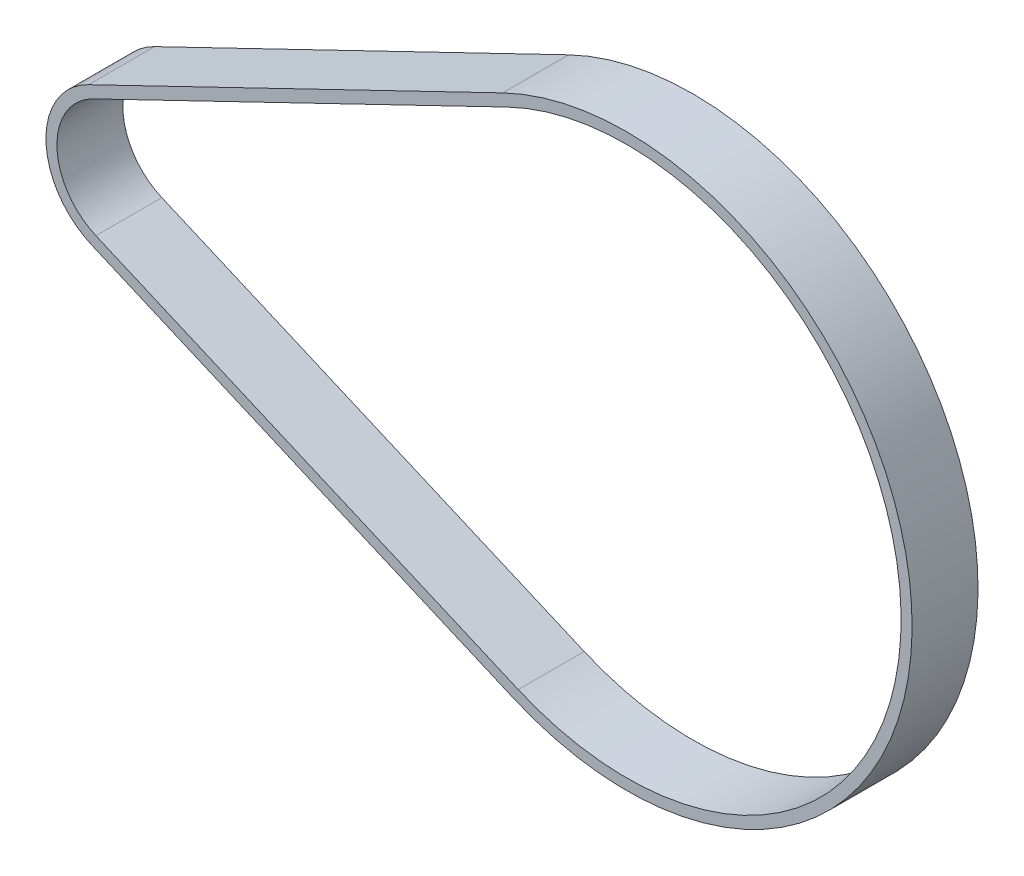
from build123d import *

# Parameters (mm, degrees)
EXTRUDE_THIN1_START = -1
EXTRUDE_THIN1_DEPTH = 6


with BuildPart() as part:
    # Sketch2 → Extrude-Thin1 (new body)
    with BuildSketch(Plane.XY.offset(EXTRUDE_THIN1_START)):
        with BuildLine():
            Line((-2.977790859, 2.682767314), (34.702240883, 20.877066234))
            ThreePointArc((34.702240883, 20.877066234), (71.951413064, -1.943417377), (35.723626633, -26.352898952))
            Line((35.723626633, -26.352898952), (-2.707742209, -9.804569909))
            ThreePointArc((-2.707742209, -9.804569909), (-6.85610972, -3.647693052), (-2.977790859, 2.682767314))
        make_face()
        with BuildLine():
            Line((-2.542965453, 1.782252535), (35.137066288, 19.976551455))
            ThreePointArc((35.137066288, 19.976551455), (70.95164682, -1.965038121), (36.119115018, -25.434427973))
            Line((36.119115018, -25.434427973), (-2.312253825, -8.886098931))
            ThreePointArc((-2.312253825, -8.886098931), (-5.856343475, -3.626072308), (-2.542965453, 1.782252535))
        make_face(mode=Mode.SUBTRACT)
    extrude(amount=-EXTRUDE_THIN1_DEPTH)


solid = part.part
